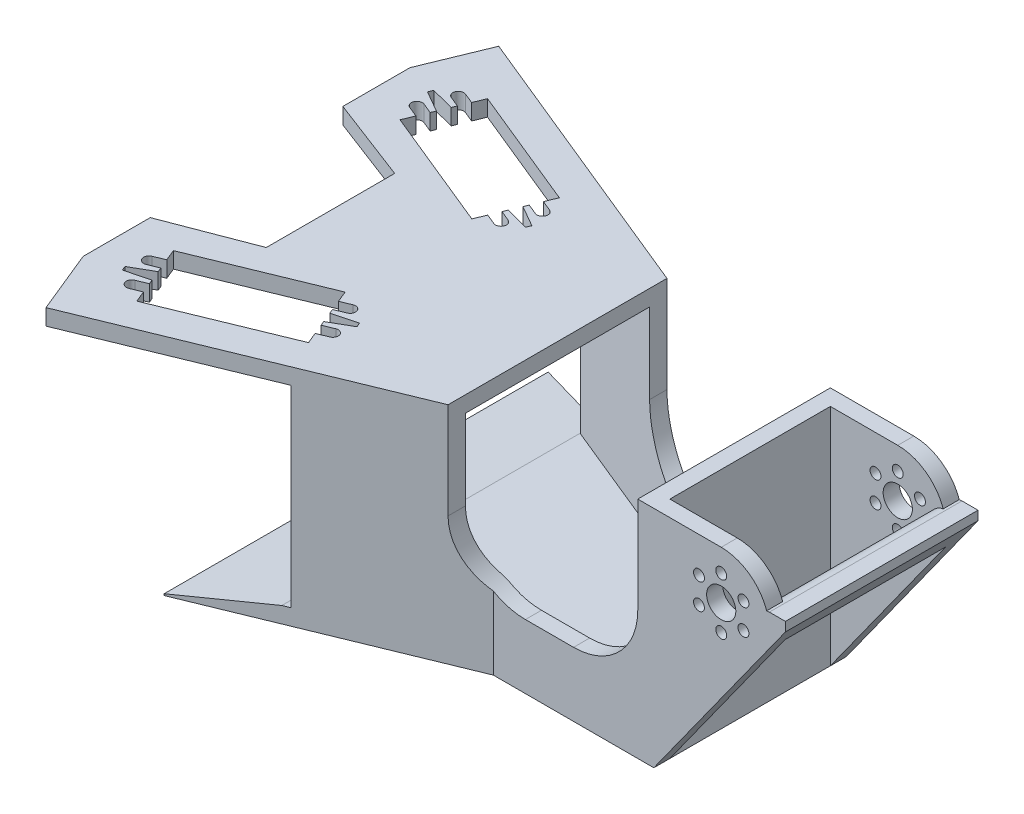
from build123d import *

# Parameters (mm, degrees)
EXTRUDE_1_DEPTH          = 5
EXTRUDE_2_DEPTH          = 60
EXTRUDE_3_DEPTH          = 5
FILLET_1_R               = 5
SKETCH_5_R               = 1.7
SKETCH_5_R_2             = 4.55
EXTRUDE_4_DEPTH          = 5
SKETCH_6_W               = 40
SKETCH_6_H               = 50
CUT_EXTRUDE_1_DEPTH      = 85
EXTRUDE_START            = -5
SKETCH_7_R               = 1.7
SKETCH_7_R_2             = 4.55
EXTRUDE_5_DEPTH          = 5
CHAMFER_1_SIZE           = 10
CHAMFER_1_SIZE2          = 4.5
CUT_EXTRUDE_3_DEPTH      = 117
CUT_EXTRUDE_3_DEPTH_BACK = 10
SKETCH_8_W               = 48.976233265
SKETCH_8_H               = 60
SKETCH_9_W               = 5
SKETCH_9_H               = 50
EXTRUDE_6_DEPTH          = 65
SKETCH_10_W              = 5
SKETCH_10_H              = 30
EXTRUDE_7_DEPTH          = 35
SKETCH_11_R              = 4.55
SKETCH_11_R_2            = 1.7
CUT_EXTRUDE_4_DEPTH      = 71
CUT_EXTRUDE_5_DEPTH      = 71
CUT_EXTRUDE_5_DEPTH_BACK = 71
SKETCH_12_R              = 1.7
SKETCH_12_R_2            = 4.55
EXTRUDE_8_DEPTH          = 5
EXTRUDE_9_DEPTH          = 5
CUT_EXTRUDE_6_DEPTH      = 5
CHAMFER_2_SIZE           = 4.5
CHAMFER_2_SIZE2          = 10
SKETCH_16_W              = 20
SKETCH_16_H              = 50
EXTRUDE_10_DEPTH         = 5
FILLET_3_R               = 20
EXTRUDE_11_DEPTH         = 52
CUT_EXTRUDE_7_DEPTH      = 52
SKETCH_19_W              = 30
SKETCH_19_H              = 50
CUT_EXTRUDE_8_DEPTH      = 96
SKETCH_20_R              = 5
EXTRUDE_12_DEPTH         = 60
SKETCH_21_W              = 5
SKETCH_21_H              = 10
EXTRUDE_13_DEPTH         = 60
SKETCH_22_W              = 35.623389922
SKETCH_22_H              = 70
CUT_EXTRUDE_9_DEPTH      = 60
SKETCH_23_W              = 5
SKETCH_23_H              = 30
EXTRUDE_14_DEPTH         = 36
SKETCH_24_R              = 4.55
SKETCH_24_R_2            = 1.7
CUT_EXTRUDE_11_DEPTH     = 61
EXTRUDE_15_DEPTH         = 5
EXTRUDE_16_DEPTH         = 5
EXTRUDE_17_DEPTH         = 60
CUT_EXTRUDE_13_DEPTH     = 22
EXTRUDE_18_DEPTH         = 5
CHAMFER_3_SIZE           = 26
CHAMFER_3_SIZE2          = 4.5
CUT_EXTRUDE_14_DEPTH     = 64
EXTRUDE_19_DEPTH         = 5
EXTRUDE_20_DEPTH         = 5


with BuildPart() as part:
    # Эскиз1 → Бобышка-Вытянуть1 (new body)
    with BuildSketch(Plane(origin=(0, 0, 0), x_dir=(1, 0, 0), z_dir=(0, 1, 0))):
        Polygon((80.736802554, -11), (-18.100616696, 29.523341892), (-26.142906256, 9.908001502), (-26.142906256, -91.908001502), (-18.100616696, -111.523341892), (80.736802554, -71), (175.736802554, -71), (175.736802554, -11), align=None)
        with BuildLine():
            Line((24.304603372, -21.259108925), (-13.630724742, -5.705624398))
            Line((-13.630724742, -5.705624398), (-12.189182273, -2.189667159))
            Line((-12.189182273, -2.189667159), (-15.427563941, -0.861930675))
            ThreePointArc((-15.427563941, -0.861930675), (-16.355591602, 1.355898142), (-14.137762786, 2.283925803))
            Line((-14.137762786, 2.283925803), (-10.899381117, 0.956189319))
            Line((-10.899381117, 0.956189319), (-10.330351196, 2.344067177))
            Line((-10.330351196, 2.344067177), (-16.890387204, 6.114468691))
            Line((-16.890387204, 6.114468691), (-16.321357282, 7.502346548))
            Line((-16.321357282, 7.502346548), (-9.002614712, 5.582448845))
            Line((-9.002614712, 5.582448845), (-8.43358479, 6.970326703))
            Line((-8.43358479, 6.970326703), (-11.671966458, 8.298063187))
            ThreePointArc((-11.671966458, 8.298063187), (-12.599994119, 10.515892004), (-10.382165302, 11.443919665))
            Line((-10.382165302, 11.443919665), (-7.143783634, 10.116183181))
            Line((-7.143783634, 10.116183181), (-5.702241166, 13.63214042))
            Line((-5.702241166, 13.63214042), (32.233086948, -1.921344106))
            Line((32.233086948, -1.921344106), (30.791544479, -5.437301346))
            Line((30.791544479, -5.437301346), (34.029926148, -6.76503783))
            ThreePointArc((34.029926148, -6.76503783), (34.957953809, -8.982866647), (32.740124992, -9.910894308))
            Line((32.740124992, -9.910894308), (29.501743324, -8.583157824))
            Line((29.501743324, -8.583157824), (28.932713402, -9.971035681))
            Line((28.932713402, -9.971035681), (35.49274941, -13.741437195))
            Line((35.49274941, -13.741437195), (34.923719488, -15.129315053))
            Line((34.923719488, -15.129315053), (27.604976918, -13.20941735))
            Line((27.604976918, -13.20941735), (27.035946996, -14.597295207))
            Line((27.035946996, -14.597295207), (30.274328664, -15.925031691))
            ThreePointArc((30.274328664, -15.925031691), (31.202356325, -18.142860508), (28.984527509, -19.070888169))
            Line((28.984527509, -19.070888169), (25.74614584, -17.743151685))
            Line((25.74614584, -17.743151685), (24.304603372, -21.259108925))
        make_face(mode=Mode.SUBTRACT)
        Polygon((50.736802554, -16), (170.736802554, -16), (170.736802554, -66), (50.736802554, -66), (50.736802554, -61.197910953), align=None, mode=Mode.SUBTRACT)
        with BuildLine():
            Line((32.233086948, -80.078655894), (-5.702241166, -95.63214042))
            Line((-5.702241166, -95.63214042), (-7.143783634, -92.116183181))
            Line((-7.143783634, -92.116183181), (-10.382165302, -93.443919665))
            ThreePointArc((-10.382165302, -93.443919665), (-12.599994119, -92.515892004), (-11.671966458, -90.298063187))
            Line((-11.671966458, -90.298063187), (-8.43358479, -88.970326703))
            Line((-8.43358479, -88.970326703), (-9.002614712, -87.582448845))
            Line((-9.002614712, -87.582448845), (-16.321357282, -89.502346548))
            Line((-16.321357282, -89.502346548), (-16.890387204, -88.114468691))
            Line((-16.890387204, -88.114468691), (-10.330351196, -84.344067177))
            Line((-10.330351196, -84.344067177), (-10.899381117, -82.956189319))
            Line((-10.899381117, -82.956189319), (-14.137762786, -84.283925803))
            ThreePointArc((-14.137762786, -84.283925803), (-16.355591602, -83.355898142), (-15.427563941, -81.138069325))
            Line((-15.427563941, -81.138069325), (-12.189182273, -79.810332841))
            Line((-12.189182273, -79.810332841), (-13.630724742, -76.294375602))
            Line((-13.630724742, -76.294375602), (24.304603372, -60.740891075))
            Line((24.304603372, -60.740891075), (25.74614584, -64.256848315))
            Line((25.74614584, -64.256848315), (28.984527509, -62.929111831))
            ThreePointArc((28.984527509, -62.929111831), (31.202356325, -63.857139492), (30.274328664, -66.074968309))
            Line((30.274328664, -66.074968309), (27.035946996, -67.402704793))
            Line((27.035946996, -67.402704793), (27.604976918, -68.79058265))
            Line((27.604976918, -68.79058265), (34.923719488, -66.870684947))
            Line((34.923719488, -66.870684947), (35.49274941, -68.258562805))
            Line((35.49274941, -68.258562805), (28.932713402, -72.028964319))
            Line((28.932713402, -72.028964319), (29.501743324, -73.416842176))
            Line((29.501743324, -73.416842176), (32.740124992, -72.089105692))
            ThreePointArc((32.740124992, -72.089105692), (34.957953809, -73.017133353), (34.029926148, -75.23496217))
            Line((34.029926148, -75.23496217), (30.791544479, -76.562698654))
            Line((30.791544479, -76.562698654), (32.233086948, -80.078655894))
        make_face(mode=Mode.SUBTRACT)
    extrude(amount=EXTRUDE_1_DEPTH)

    # Эскиз2 → Бобышка-Вытянуть2 (add)
    with BuildSketch(Plane.XZ):
        Polygon((36.026619759, 89.331174946), (34.129853353, 84.70491542), (78.840036148, 66.373740474), (80.736802554, 66), (170.736802554, 66), (170.736802554, 16), (80.736802554, 16), (78.840036148, 15.626259526), (34.129853353, -2.70491542), (36.026619759, -7.331174946), (80.736802554, 11), (175.736802554, 11), (175.736802554, 71), (80.736802554, 71), align=None)
    extrude(amount=EXTRUDE_2_DEPTH)

    # Эскиз3 → Бобышка-Вытянуть3 (add)
    with BuildSketch(Plane.XZ.offset(60)):
        Polygon((175.736802554, 71), (80.736802554, 71), (-18.100616696, 111.523341892), (-26.142906256, 91.908001502), (-26.142906256, -9.908001502), (-18.100616696, -29.523341892), (80.736802554, 11), (175.736802554, 11), align=None)
    extrude(amount=EXTRUDE_3_DEPTH)

    # Скругление1
    fillet_1_edges = [part.edges().sort_by_distance(p)[0] for p in [
        (175.736802554, -30, 11),
        (175.736802554, -30, 71),
    ]]
    fillet(fillet_1_edges, radius=FILLET_1_R)

    # Эскиз5 → Бобышка-Вытянуть4 (add)
    with BuildSketch(Plane(origin=(0, 0, 11), x_dir=(-1, 0, 0), z_dir=(0, 0, -1))):
        with BuildLine():
            Line((-85.736802554, 5), (-55.736802554, 5))
            Line((-55.736802554, 5), (-55.736802554, 25))
            ThreePointArc((-55.736802554, 25), (-70.736802554, 40), (-85.736802554, 25))
            Line((-85.736802554, 25), (-85.736802554, 5))
        make_face()
        with Locations((-77.665005784, 21)):
            Circle(SKETCH_5_R, mode=Mode.SUBTRACT)
        with Locations((-70.736802554, 17)):
            Circle(SKETCH_5_R, mode=Mode.SUBTRACT)
        with Locations((-63.808599324, 21)):
            Circle(SKETCH_5_R, mode=Mode.SUBTRACT)
        with Locations((-63.808599324, 29)):
            Circle(SKETCH_5_R, mode=Mode.SUBTRACT)
        with Locations((-70.736802554, 33)):
            Circle(SKETCH_5_R, mode=Mode.SUBTRACT)
        with Locations((-77.665005784, 29)):
            Circle(SKETCH_5_R, mode=Mode.SUBTRACT)
        with Locations((-70.736802554, 25)):
            Circle(SKETCH_5_R_2, mode=Mode.SUBTRACT)
    extrude(amount=-EXTRUDE_4_DEPTH)

    # Эскиз6 → Вырез-Вытянуть1 (cut)
    with BuildSketch(Plane(origin=(0, 0, 11), x_dir=(-1, 0, 0), z_dir=(0, 0, -1))):
        with Locations((-105.736802554, -20)):
            Rectangle(SKETCH_6_W, SKETCH_6_H)
    extrude(amount=-CUT_EXTRUDE_1_DEPTH, mode=Mode.SUBTRACT)

    # Эскиз7 → Бобышка-Вытянуть5 (add)
    with BuildSketch(Plane.XY.offset(71).offset(EXTRUDE_START)):
        with BuildLine():
            Line((85.736802554, 5), (85.736802554, 25))
            ThreePointArc((85.736802554, 25), (70.736802554, 40), (55.736802554, 25))
            Line((55.736802554, 25), (55.736802554, 5))
            Line((55.736802554, 5), (85.736802554, 5))
        make_face()
        with Locations((77.665005784, 29)):
            Circle(SKETCH_7_R, mode=Mode.SUBTRACT)
        with Locations((63.808599324, 21)):
            Circle(SKETCH_7_R, mode=Mode.SUBTRACT)
        with Locations((70.736802554, 17)):
            Circle(SKETCH_7_R, mode=Mode.SUBTRACT)
        with Locations((77.665005784, 21)):
            Circle(SKETCH_7_R, mode=Mode.SUBTRACT)
        with Locations((70.736802554, 25)):
            Circle(SKETCH_7_R_2, mode=Mode.SUBTRACT)
        with Locations((63.808599324, 29)):
            Circle(SKETCH_7_R, mode=Mode.SUBTRACT)
        with Locations((70.736802554, 33)):
            Circle(SKETCH_7_R, mode=Mode.SUBTRACT)
    extrude(amount=EXTRUDE_5_DEPTH)

    # Фаска1
    chamfer_1_edges = [part.edges().sort_by_distance(p)[0] for p in [
        (-22.121761476, -60, 101.715671697),
        (-22.121761476, -60, -19.715671697),
        (-26.142906256, -60, 41),
    ]]
    chamfer_1_side = [part.faces().sort_by_distance(p)[0] for p in [
        (51.013809449, -60, 41),
    ]]
    chamfer(chamfer_1_edges, length=CHAMFER_1_SIZE, length2=CHAMFER_1_SIZE2, reference=chamfer_1_side[0])

    # Эскиз8 → Вырез-Вытянуть3 (cut, two sides: drawn at the far end of the back side and taken through both)
    with BuildSketch(Plane(origin=(0, -60, 0), x_dir=(1, 0, 0), z_dir=(0, 1, 0)).offset(-CUT_EXTRUDE_3_DEPTH_BACK)):
        with Locations((155.224919187, -41)):
            Rectangle(SKETCH_8_W, SKETCH_8_H)
    extrude(amount=CUT_EXTRUDE_3_DEPTH + CUT_EXTRUDE_3_DEPTH_BACK, mode=Mode.SUBTRACT)

    # Эскиз9 → Бобышка-Вытянуть6 (add)
    with BuildSketch(Plane(origin=(0, -60, 0), x_dir=(1, 0, 0), z_dir=(0, 1, 0))):
        with Locations((128.236802554, -41)):
            Rectangle(SKETCH_9_W, SKETCH_9_H)
    extrude(amount=EXTRUDE_6_DEPTH)

    # Эскиз10 → Бобышка-Вытянуть7 (add)
    with BuildSketch(Plane(origin=(130.736802554, 0, 0), x_dir=(0, 0, -1), z_dir=(1, 0, 0))):
        with Locations((-13.5, -10)):
            Rectangle(SKETCH_10_W, SKETCH_10_H)
        with Locations((-68.5, -10)):
            Rectangle(SKETCH_10_W, SKETCH_10_H)
    extrude(amount=EXTRUDE_7_DEPTH)

    # Эскиз11 → Вырез-Вытянуть4 (cut)
    with BuildSketch(Plane.XY.offset(71)):
        with Locations((145.736802554, -10)):
            Circle(SKETCH_11_R)
        with BuildLine():
            Line((165.736802554, 5), (145.736802554, 5))
            ThreePointArc((145.736802554, 5), (158.760449686, -2.557915925), (158.659879477, -17.615384615))
            Line((158.659879477, -17.615384615), (154.308231126, -25))
            Line((154.308231126, -25), (165.736802554, -25))
            Line((165.736802554, -25), (165.736802554, 5))
        make_face()
        with Locations((138.808599324, -6)):
            Circle(SKETCH_11_R_2)
        with Locations((138.808599324, -14)):
            Circle(SKETCH_11_R_2)
        with Locations((145.736802554, -2)):
            Circle(SKETCH_11_R_2)
        with Locations((145.736802554, -18)):
            Circle(SKETCH_11_R_2)
        with Locations((152.665005784, -6)):
            Circle(SKETCH_11_R_2)
        with Locations((152.665005784, -14)):
            Circle(SKETCH_11_R_2)
    extrude(amount=-CUT_EXTRUDE_4_DEPTH, mode=Mode.SUBTRACT)

    # Эскиз12 → Вырез-Вытянуть5 (cut, two sides: drawn at the far end of the back side and taken through both)
    with BuildSketch(Plane.XY.offset(71).offset(-CUT_EXTRUDE_5_DEPTH_BACK)):
        with BuildLine():
            Line((85.736802554, -45), (85.736802554, 25))
            ThreePointArc((85.736802554, 25), (70.736802554, 40), (55.736802554, 25))
            Line((55.736802554, 25), (55.736802554, 5))
            Line((55.736802554, 5), (70.736802554, 5))
            Line((70.736802554, 5), (70.736802554, -45))
            Line((70.736802554, -45), (85.736802554, -45))
        make_face()
        with Locations((77.665005784, 29)):
            Circle(SKETCH_12_R, mode=Mode.SUBTRACT)
        with Locations((77.665005784, 21)):
            Circle(SKETCH_12_R, mode=Mode.SUBTRACT)
        with Locations((70.736802554, 17)):
            Circle(SKETCH_12_R, mode=Mode.SUBTRACT)
        with Locations((63.808599324, 21)):
            Circle(SKETCH_12_R, mode=Mode.SUBTRACT)
        with Locations((63.808599324, 29)):
            Circle(SKETCH_12_R, mode=Mode.SUBTRACT)
        with Locations((70.736802554, 25)):
            Circle(SKETCH_12_R_2, mode=Mode.SUBTRACT)
        with Locations((70.736802554, 33)):
            Circle(SKETCH_12_R, mode=Mode.SUBTRACT)
    extrude(amount=CUT_EXTRUDE_5_DEPTH + CUT_EXTRUDE_5_DEPTH_BACK, mode=Mode.SUBTRACT)

    # Эскиз13 → Бобышка-Вытянуть8 (add)
    with BuildSketch(Plane.XY.offset(71)):
        Polygon((130.736802554, -65), (154.308231126, -25), (130.736802554, -25), align=None)
    extrude(amount=-EXTRUDE_8_DEPTH)

    # Эскиз14 → Бобышка-Вытянуть9 (add)
    with BuildSketch(Plane(origin=(0, 0, 11), x_dir=(-1, 0, 0), z_dir=(0, 0, -1))):
        Polygon((-154.308231126, -25), (-130.736802554, -65), (-130.736802554, -25), align=None)
    extrude(amount=-EXTRUDE_9_DEPTH)

    # Эскиз15 → Вырез-Вытянуть6 (cut)
    with BuildSketch(Plane.XZ.offset(65)):
        Polygon((-18.100616696, -29.523341892), (0, -22.102089047), (0, 104.102089047), (-18.100616696, 111.523341892), (-26.142906256, 91.908001502), (-26.142906256, -9.908001502), align=None)
    extrude(amount=-CUT_EXTRUDE_6_DEPTH, mode=Mode.SUBTRACT)

    # Фаска2
    chamfer_2_edges = [part.edges().sort_by_distance(p)[0] for p in [
        (0, -60, 41),
    ]]
    chamfer_2_side = [part.faces().sort_by_distance(p)[0] for p in [
        (0, -62.5, 41),
    ]]
    chamfer(chamfer_2_edges, length=CHAMFER_2_SIZE, length2=CHAMFER_2_SIZE2, reference=chamfer_2_side[0])

    # Эскиз16 → Бобышка-Вытянуть10 (add)
    with BuildSketch(Plane(origin=(0, 5, 0), x_dir=(1, 0, 0), z_dir=(0, 1, 0))):
        with Locations((60.736802554, -41)):
            Rectangle(SKETCH_16_W, SKETCH_16_H)
    extrude(amount=-EXTRUDE_10_DEPTH)

    # Скругление3
    fillet_3_edges = [part.edges().sort_by_distance(p)[0] for p in [
        (70.736802554, -45, 72.398033124),
        (70.736802554, -45, 9.601966876),
        (125.736802554, -45, 68.5),
        (125.736802554, -45, 13.5),
    ]]
    fillet(fillet_3_edges, radius=FILLET_3_R)

    # Эскиз17 → Бобышка-Вытянуть11 (add)
    with BuildSketch(Plane(origin=(0, 0, 66), x_dir=(-1, 0, 0), z_dir=(0, 0, -1))):
        with BuildLine():
            Line((-130.736802554, 3), (-130.736802554, 5))
            Line((-130.736802554, 5), (-145.736802554, 5))
            ThreePointArc((-145.736802554, 5), (-158.760449686, -2.557915925), (-158.659879477, -17.615384615))
            Line((-158.659879477, -17.615384615), (-130.736802554, -65))
            Line((-130.736802554, -65), (-130.736802554, -61.060606062))
            Line((-130.736802554, -61.060606062), (-156.936802554, -16.6))
            ThreePointArc((-156.936802554, -16.6), (-157.023963402, -3.550193801), (-145.736802554, 3))
            Line((-145.736802554, 3), (-130.736802554, 3))
        make_face()
    extrude(amount=EXTRUDE_11_DEPTH)

    # Эскиз18 → Вырез-Вытянуть7 (cut)
    with BuildSketch(Plane(origin=(0, 5, 0), x_dir=(1, 0, 0), z_dir=(0, 1, 0))):
        Polygon((0, -21), (-26.142906256, -11), (-26.142906256, -71), (0, -61), align=None)
    extrude(amount=-CUT_EXTRUDE_7_DEPTH, mode=Mode.SUBTRACT)

    # Эскиз19 → Вырез-Вытянуть8 (cut)
    with BuildSketch(Plane(origin=(0, 5, 0), x_dir=(1, 0, 0), z_dir=(0, 1, 0))):
        with Locations((145.736802554, -41)):
            Rectangle(SKETCH_19_W, SKETCH_19_H)
    extrude(amount=-CUT_EXTRUDE_8_DEPTH, mode=Mode.SUBTRACT)

    # Эскиз20 → Бобышка-Вытянуть12 (add)
    with BuildSketch(Plane.XY.offset(71)):
        with Locations((160.736802554, -10)):
            Circle(SKETCH_20_R)
    extrude(amount=-EXTRUDE_12_DEPTH)

    # Эскиз21 → Бобышка-Вытянуть13 (add)
    with BuildSketch(Plane.XY.offset(71)):
        with Locations((163.236802554, -10)):
            Rectangle(SKETCH_21_W, SKETCH_21_H)
    extrude(amount=-EXTRUDE_13_DEPTH)

    # Эскиз22 → Вырез-Вытянуть9 (cut)
    with BuildSketch(Plane.XY.offset(71)):
        with Locations((148.548497515, -30)):
            Rectangle(SKETCH_22_W, SKETCH_22_H)
    extrude(amount=-CUT_EXTRUDE_9_DEPTH, mode=Mode.SUBTRACT)

    # Эскиз23 → Бобышка-Вытянуть14 (add)
    with BuildSketch(Plane(origin=(130.736802554, 0, 0), x_dir=(0, 0, -1), z_dir=(1, 0, 0))):
        with Locations((-68.5, -10)):
            Rectangle(SKETCH_23_W, SKETCH_23_H)
        with Locations((-13.5, -10)):
            Rectangle(SKETCH_23_W, SKETCH_23_H)
    extrude(amount=EXTRUDE_14_DEPTH)

    # Эскиз24 → Вырез-Вытянуть11 (cut)
    with BuildSketch(Plane.XY.offset(71)):
        with Locations((151.736802554, -10)):
            Circle(SKETCH_24_R)
        with BuildLine():
            ThreePointArc((166.736802554, -10), (162.343404272, -20.606601718), (151.736802554, -25))
            Line((151.736802554, -25), (166.736802554, -25))
            Line((166.736802554, -25), (166.736802554, -10))
        make_face()
        with BuildLine():
            ThreePointArc((151.736802554, 5), (162.343404272, 0.606601718), (166.736802554, -10))
            Line((166.736802554, -10), (166.736802554, 5))
            Line((166.736802554, 5), (151.736802554, 5))
        make_face()
        with Locations((144.808599324, -6)):
            Circle(SKETCH_24_R_2)
        with Locations((144.808599324, -14)):
            Circle(SKETCH_24_R_2)
        with Locations((151.736802554, -2)):
            Circle(SKETCH_24_R_2)
        with Locations((151.736802554, -18)):
            Circle(SKETCH_24_R_2)
        with Locations((158.665005784, -6)):
            Circle(SKETCH_24_R_2)
        with Locations((158.665005784, -14)):
            Circle(SKETCH_24_R_2)
    extrude(amount=-CUT_EXTRUDE_11_DEPTH, mode=Mode.SUBTRACT)

    # Эскиз25 → Бобышка-Вытянуть15 (add)
    with BuildSketch(Plane.XY.offset(71)):
        Polygon((130.736802554, -65), (163.924359243, -18.744338852), (130.736802554, -25), align=None)
    extrude(amount=-EXTRUDE_15_DEPTH)

    # Эскиз26 → Бобышка-Вытянуть16 (add)
    with BuildSketch(Plane(origin=(0, 0, 11), x_dir=(-1, 0, 0), z_dir=(0, 0, -1))):
        Polygon((-130.736802554, -25), (-163.924359243, -18.744338852), (-130.736802554, -65), align=None)
    extrude(amount=-EXTRUDE_16_DEPTH)

    # Эскиз27 → Бобышка-Вытянуть17 (add)
    with BuildSketch(Plane(origin=(0, 0, 11), x_dir=(-1, 0, 0), z_dir=(0, 0, -1))):
        with BuildLine():
            Line((-171.736802554, -5), (-171.736802554, -15))
            Line((-171.736802554, -15), (-166.736802554, -15))
            ThreePointArc((-166.736802554, -15), (-161.736802554, -10), (-166.736802554, -5))
            Line((-166.736802554, -5), (-171.736802554, -5))
        make_face()
    extrude(amount=-EXTRUDE_17_DEPTH)

    # Эскиз28 → Вырез-Вытянуть13 (cut)
    with BuildSketch(Plane.XZ.offset(65)):
        Polygon((0, 104.102089047), (0, -22.102089047), (8, -18.822089047), (8, 100.822089047), align=None)
    extrude(amount=-CUT_EXTRUDE_13_DEPTH, mode=Mode.SUBTRACT)

    # Эскиз29 → Бобышка-Вытянуть18 (add)
    with BuildSketch(Plane.XZ.offset(65)):
        Polygon((8, 100.822089047), (14.793859773, 98.03660654), (14.793859773, -16.03660654), (8, -18.822089047), align=None)
    extrude(amount=-EXTRUDE_18_DEPTH)

    # Фаска3
    chamfer_3_edges = [part.edges().sort_by_distance(p)[0] for p in [
        (8, -60, 41),
    ]]
    chamfer_3_side = [part.faces().sort_by_distance(p)[0] for p in [
        (56.370500487, -60, 41),
    ]]
    chamfer(chamfer_3_edges, length=CHAMFER_3_SIZE, length2=CHAMFER_3_SIZE2, reference=chamfer_3_side[0])

    # Эскиз30 → Вырез-Вытянуть14 (cut)
    with BuildSketch(Plane.XY.offset(71)):
        Polygon((163.924358694, -18.744339617), (171.736802554, -7.855627341), (171.736802554, -15), align=None)
    extrude(amount=-CUT_EXTRUDE_14_DEPTH, mode=Mode.SUBTRACT)

    # Эскиз31 → Бобышка-Вытянуть19 (add)
    with BuildSketch(Plane.XY.offset(71)):
        Polygon((163.776446384, -17.475414854), (163.924358694, -18.744339617), (166.611969367, -14.998441425), (165.903469221, -13.592139542), align=None)
    extrude(amount=-EXTRUDE_19_DEPTH)

    # Эскиз32 → Бобышка-Вытянуть20 (add)
    with BuildSketch(Plane(origin=(0, 0, 11), x_dir=(-1, 0, 0), z_dir=(0, 0, -1))):
        Polygon((-163.924359243, -18.744338852), (-166.611969367, -14.998441425), (-165.903469221, -14.930066486), align=None)
    extrude(amount=-EXTRUDE_20_DEPTH)


solid = part.part
